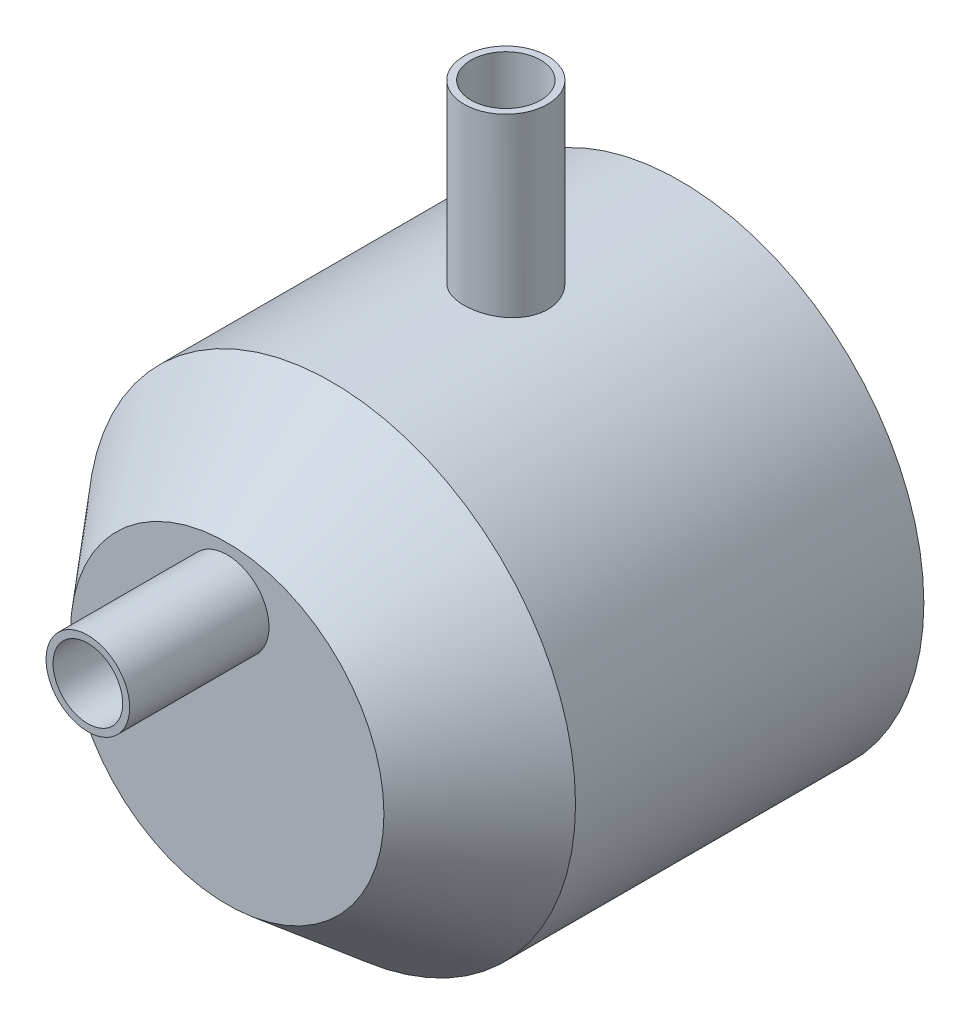
from build123d import *

# Parameters (mm, degrees)
SKETCH_1_R           = 35
SKETCH_1_R_2         = 25
EXTRUDE_1_DEPTH      = 25
SKETCH_2_R           = 1.5
CUT_EXTRUDE_1_DEPTH  = 10
SKETCH_4_R           = 22.5
SKETCH_3_R           = 35
EXTRUDE_2_REACH      = 110.858
EXTRUDE_2_END_RADIUS = 35
SKETCH_7_R           = 6
SKETCH_7_R_2         = 5
SKETCH_9_R           = 6
SKETCH_9_R_2         = 5
EXTRUDE_3_DEPTH      = 20


with BuildPart() as part:
    # 草图1 → 凸台-拉伸1 (new, symmetric)
    with BuildSketch(Plane.XY):
        Circle(SKETCH_1_R)
        Circle(SKETCH_1_R_2, mode=Mode.SUBTRACT)
    extrude(amount=EXTRUDE_1_DEPTH, both=True)

    # 草图2 → 切除-拉伸1 (cut)
    with BuildSketch(Plane(origin=(0, 0, -25), x_dir=(-1, 0, 0), z_dir=(0, 0, -1))):
        with Locations((0, 28.75)):
            Circle(SKETCH_2_R)
        with Locations((28.75, 0)):
            Circle(SKETCH_2_R)
        with Locations((0, -28.75)):
            Circle(SKETCH_2_R)
        with Locations((-28.75, 0)):
            Circle(SKETCH_2_R)
    extrude(amount=-CUT_EXTRUDE_1_DEPTH, mode=Mode.SUBTRACT)

    # 草图4 → Loft 1 section 0
    with BuildSketch(Plane.XY.offset(40)):
        Circle(SKETCH_4_R)
    # 草图3 → Loft 1 section 1
    with BuildSketch(Plane.XY.offset(25)):
        Circle(SKETCH_3_R)
    loft()

    # Loft 1 2: read off the stored shape, not the designer's step
    # Loft 1 2: loft between two sections, ruled curve by curve
    loft_1_2_from = [
        Edge.make_bspline([(-17.413546016, 7.600553608, 37), (-2.212438801, 42.42764564, 37), (32.614653231, 27.226538425, 37), (17.413546016, -7.600553608, 37), (2.212438801, -42.42764564, 37), (-32.614653231, -27.226538425, 37), (-17.413546016, 7.600553608, 37)], [0, 0, 0, 0, 0.5, 0.5, 0.5, 1, 1, 1, 1], 3, [1, 0.333333333, 0.333333333, 1, 0.333333333, 0.333333333, 1]),
    ]
    loft_1_2_to = [
        Edge.make_bspline([(-12.914827658, 21.405775542, 25), (29.896723426, 47.235430858, 25), (55.726378742, 4.423879774, 25), (12.914827658, -21.405775542, 25), (-29.896723426, -47.235430858, 25), (-55.726378742, -4.423879774, 25), (-12.914827658, 21.405775542, 25)], [0, 0, 0, 0, 0.5, 0.5, 0.5, 1, 1, 1, 1], 3, [1, 0.333333333, 0.333333333, 1, 0.333333333, 0.333333333, 1]),
    ]
    loft_1_2 = Solid(Shell([*[Face.make_surface_from_curves(loft_1_2_from[k], loft_1_2_to[k]) for k in range(1)], Face(Wire(loft_1_2_from)), Face(Wire(loft_1_2_to))]))
    add(loft_1_2, mode=Mode.SUBTRACT)

    # 凸台-拉伸2: up to this cylinder (the profile starts outside it)
    extrude_2_end = Plane(origin=(0, 0, -5.830294), z_dir=(0, 0, -1)) * Cylinder(EXTRUDE_2_END_RADIUS, 292.716, mode=Mode.PRIVATE)
    # 草图7 → 凸台-拉伸2 (add, up to the surface)
    with BuildSketch(Plane(origin=(0, 60, 0), x_dir=(1, 0, 0), z_dir=(0, 1, 0)), mode=Mode.PRIVATE) as extrude_2_sk1:
        with Locations(Location((0, 0, 0), (0, 0, 270))):
            Circle(SKETCH_7_R)
        with Locations(Location((0, 0, 0), (0, 0, 270))):
            Circle(SKETCH_7_R_2, mode=Mode.SUBTRACT)
    extrude_2_tool1 = extrude(extrude_2_sk1.sketch, amount=-EXTRUDE_2_REACH, mode=Mode.PRIVATE) - extrude_2_end
    add(extrude_2_tool1.solids().sort_by_distance((0, 60, -5.830294))[0])

    # 草图9 → 凸台-拉伸3 (add)
    with BuildSketch(Plane.XY.offset(60)):
        with Locations((0, 15)):
            Circle(SKETCH_9_R)
        with Locations((0, 15)):
            Circle(SKETCH_9_R_2, mode=Mode.SUBTRACT)
    extrude(amount=-EXTRUDE_3_DEPTH)


solid = part.part
